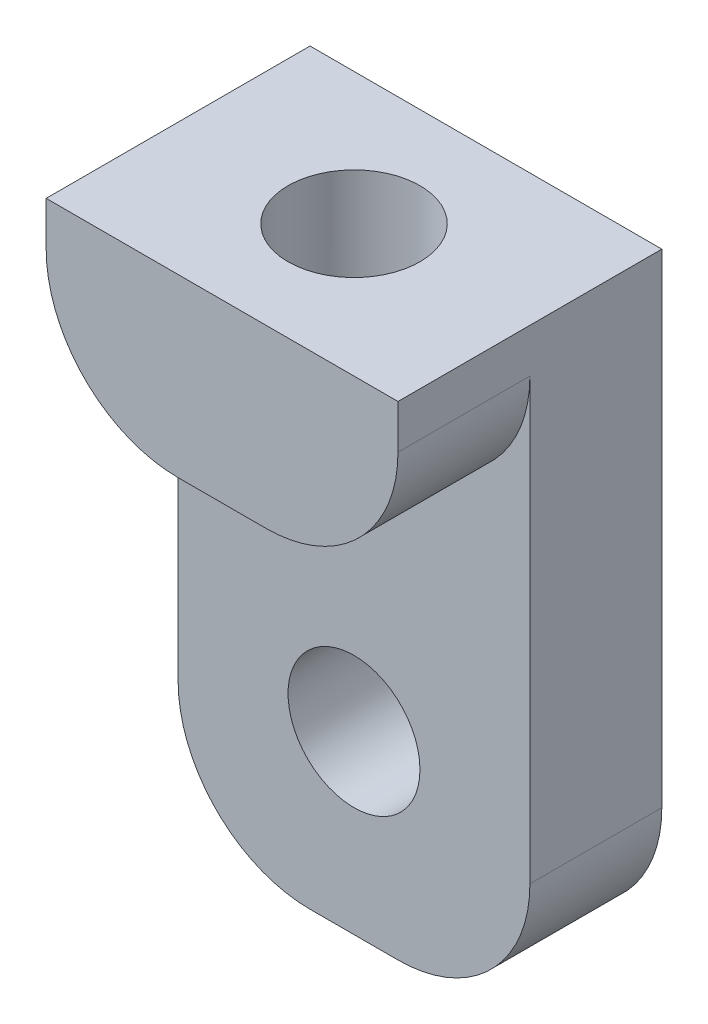
from build123d import *

# Parameters (mm, degrees)
SKETCH1_W           = 40
SKETCH1_H           = 70
SKETCH1_R           = 7.5
BOSS_EXTRUDE1_DEPTH = 30
CUT_EXTRUDE1_DEPTH  = 20
SKETCH3_W           = 40
SKETCH3_H           = 50
CUT_EXTRUDE2_DEPTH  = 15
FILLET1_R           = 15


with BuildPart() as part:
    # Sketch1 → Boss-Extrude1 (new body)
    with BuildSketch(Plane.XY):
        with Locations((0, 15)):
            Rectangle(SKETCH1_W, SKETCH1_H)
        Circle(SKETCH1_R, mode=Mode.SUBTRACT)
    extrude(amount=BOSS_EXTRUDE1_DEPTH)

    # Sketch2 → Cut-Extrude1 (cut)
    with BuildSketch(Plane(origin=(0, 50, 0), x_dir=(1, 0, 0), z_dir=(0, 1, 0))):
        with BuildLine():
            ThreePointArc((7.5, -15), (2.371708245, -7.884875265), (-6, -10.5))
            Line((-6, -10.5), (6, -19.5))
            ThreePointArc((6, -19.5), (7.115124735, -17.371708245), (7.5, -15))
        make_face()
        with BuildLine():
            Line((6, -19.5), (-6, -10.5))
            ThreePointArc((-6, -10.5), (-4.5, -21), (6, -19.5))
        make_face()
    extrude(amount=-CUT_EXTRUDE1_DEPTH, mode=Mode.SUBTRACT)

    # Sketch3 → Cut-Extrude2 (cut)
    with BuildSketch(Plane.XY.offset(30)):
        with Locations((0, 5)):
            Rectangle(SKETCH3_W, SKETCH3_H)
    extrude(amount=-CUT_EXTRUDE2_DEPTH, mode=Mode.SUBTRACT)

    # Fillet1
    # the kernel refuses this fillet: 15 mm, written as the material it takes off along each edge
    with BuildSketch(Plane(origin=(20, -20, -37.5), x_dir=(0, 1, 0), z_dir=(0, 0, 1))) as fillet1_piece_1:
        with BuildLine():
            CenterArc((FILLET1_R, FILLET1_R), FILLET1_R, 180, 90)
            Line((0, FILLET1_R), (0, 0))
            Line((0, 0), (FILLET1_R, 0))
        make_face()
    extrude(amount=90, mode=Mode.SUBTRACT)
    with BuildSketch(Plane(origin=(-20, -20, -37.5), x_dir=(0, 1, 0), z_dir=(0, 0, 1))) as fillet1_piece_2:
        with BuildLine():
            CenterArc((FILLET1_R, -FILLET1_R), FILLET1_R, 90, 90)
            Line((0, -FILLET1_R), (0, 0))
            Line((0, 0), (FILLET1_R, 0))
        make_face()
    extrude(amount=90, mode=Mode.SUBTRACT)
    with BuildSketch(Plane(origin=(-20, 30, 67.5), x_dir=(0, 1, 0), z_dir=(0, 0, -1))) as fillet1_piece_3:
        with BuildLine():
            CenterArc((FILLET1_R, FILLET1_R), FILLET1_R, 180, 90)
            Line((0, FILLET1_R), (0, 0))
            Line((0, 0), (FILLET1_R, 0))
        make_face()
    extrude(amount=52.5, mode=Mode.SUBTRACT)
    with BuildSketch(Plane(origin=(20, 30, 67.5), x_dir=(0, 1, 0), z_dir=(0, 0, -1))) as fillet1_piece_4:
        with BuildLine():
            CenterArc((FILLET1_R, -FILLET1_R), FILLET1_R, 90, 90)
            Line((0, -FILLET1_R), (0, 0))
            Line((0, 0), (FILLET1_R, 0))
        make_face()
    extrude(amount=52.5, mode=Mode.SUBTRACT)


solid = part.part
